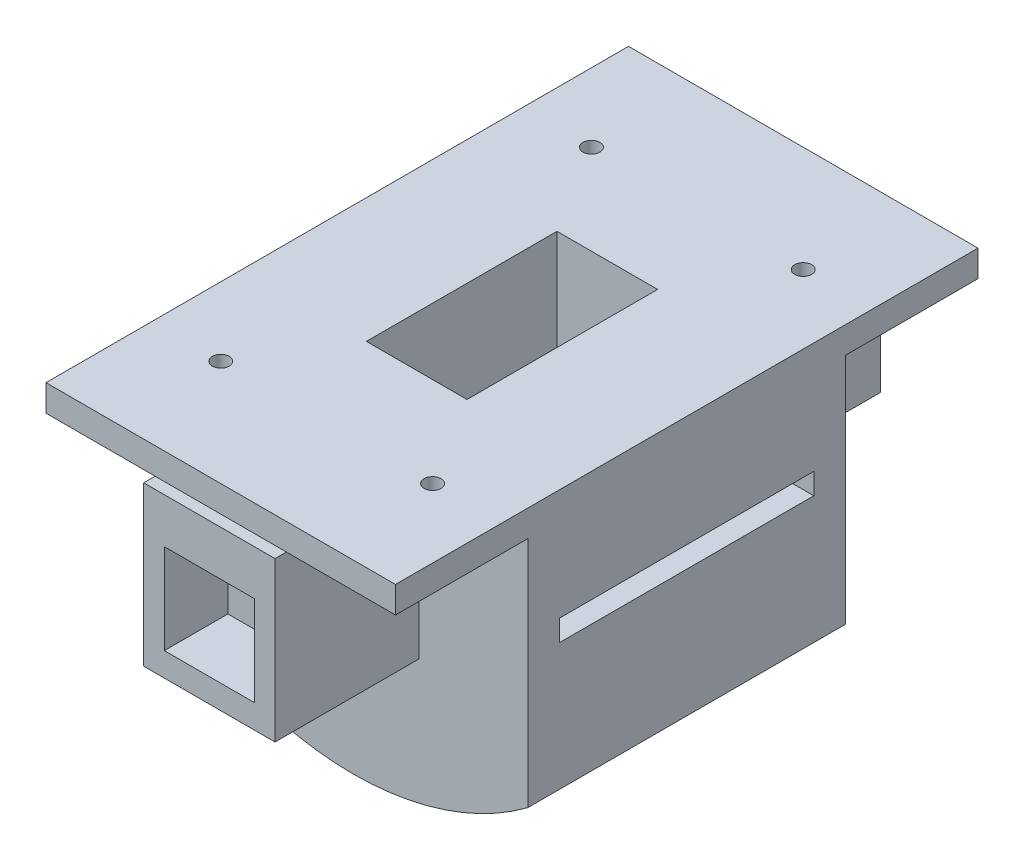
from build123d import *

# Parameters (mm, degrees)
BOSS_EXTRUDE1_DEPTH      = 30
BOSS_EXTRUDE1_DEPTH_BACK = 30
CUT_EXTRUDE1_DEPTH       = 18
CUT_EXTRUDE1_DEPTH_BACK  = 18
SKETCH2_W                = 19
SKETCH2_H                = 42
SKETCH3_W                = 21.854352608
SKETCH3_H                = 45
CUT_EXTRUDE2_DEPTH       = 99.234413522
SKETCH4_R                = 1.6
CUT_EXTRUDE3_DEPTH       = 84.366660003
SKETCH6_W                = 48
SKETCH6_H                = 4
CUT_EXTRUDE5_DEPTH       = 22
SKETCH9_W                = 22
SKETCH9_H                = 60
CUT_EXTRUDE7_DEPTH       = 84.366660003
SKETCH10_W               = 66
SKETCH10_H               = 110
SKETCH10_W_2             = 19
SKETCH10_H_2             = 36
BOSS_EXTRUDE2_DEPTH      = 5
SKETCH11_R               = 1.6
CUT_EXTRUDE8_DEPTH       = 88.82938005
SKETCH13_W               = 24.8
SKETCH13_H               = 30
BOSS_EXTRUDE3_DEPTH      = 27.15
SKETCH14_W               = 17
SKETCH14_H               = 17
CUT_EXTRUDE9_DEPTH       = 12


with BuildPart() as part:
    # Sketch1 → Boss-Extrude1 (new, two sides: drawn at the far end of the back side and taken through both)
    with BuildSketch(Plane.XY.offset(-BOSS_EXTRUDE1_DEPTH_BACK)):
        with BuildLine():
            Line((55, 0), (0, 0))
            Line((0, 0), (-55, 0))
            ThreePointArc((-55, 0), (0, -55), (55, 0))
        make_face()
    extrude(amount=BOSS_EXTRUDE1_DEPTH + BOSS_EXTRUDE1_DEPTH_BACK)

    # Sketch2 → Cut-Extrude1 (cut, two sides: drawn at the far end of the back side and taken through both)
    with BuildSketch(Plane.XY.offset(-CUT_EXTRUDE1_DEPTH_BACK)):
        with Locations((0, -21)):
            Rectangle(SKETCH2_W, SKETCH2_H)
    extrude(amount=CUT_EXTRUDE1_DEPTH + CUT_EXTRUDE1_DEPTH_BACK, mode=Mode.SUBTRACT)

    # Sketch3 → Cut-Extrude2 (cut, through all)
    with BuildSketch(Plane.XY.offset(30)):
        with Locations((-43.927176304, -26.5)):
            Rectangle(SKETCH3_W, SKETCH3_H)
        with Locations((43.927176304, -26.5)):
            Rectangle(SKETCH3_W, SKETCH3_H)
    extrude(amount=-CUT_EXTRUDE2_DEPTH, mode=Mode.SUBTRACT)

    # Sketch4 → Cut-Extrude3 (cut, through all)
    with BuildSketch(Plane(origin=(0, 0, 0), x_dir=(1, 0, 0), z_dir=(0, 1, 0))):
        with Locations((45, 20)):
            Circle(SKETCH4_R)
        with Locations((45, -20)):
            Circle(SKETCH4_R)
        with Locations((-45, -20)):
            Circle(SKETCH4_R)
        with Locations((-45, 20)):
            Circle(SKETCH4_R)
    extrude(amount=-CUT_EXTRUDE3_DEPTH, mode=Mode.SUBTRACT)

    # Sketch6 → Cut-Extrude5 (cut)
    with BuildSketch(Plane(origin=(33, 0, 0), x_dir=(0, 0, -1), z_dir=(1, 0, 0))):
        with Locations((0, -18)):
            Rectangle(SKETCH6_W, SKETCH6_H)
    extrude(amount=-CUT_EXTRUDE5_DEPTH, mode=Mode.SUBTRACT)

    # Sketch9 → Cut-Extrude7 (cut, through all)
    with BuildSketch(Plane(origin=(0, 0, 0), x_dir=(1, 0, 0), z_dir=(0, 1, 0))):
        with Locations((-44, 0)):
            Rectangle(SKETCH9_W, SKETCH9_H)
        with Locations((44, 0)):
            Rectangle(SKETCH9_W, SKETCH9_H)
    extrude(amount=-CUT_EXTRUDE7_DEPTH, mode=Mode.SUBTRACT)

    # Sketch10 → Boss-Extrude2 (add)
    with BuildSketch(Plane(origin=(0, 0, 0), x_dir=(1, 0, 0), z_dir=(0, 1, 0))):
        Rectangle(SKETCH10_W, SKETCH10_H)
        Rectangle(SKETCH10_W_2, SKETCH10_H_2, mode=Mode.SUBTRACT)
    extrude(amount=BOSS_EXTRUDE2_DEPTH)

    # Sketch11 → Cut-Extrude8 (cut, through all)
    with BuildSketch(Plane(origin=(0, 5, 0), x_dir=(1, 0, 0), z_dir=(0, 1, 0))):
        with Locations((-20, 35)):
            Circle(SKETCH11_R)
        with Locations((20, 35)):
            Circle(SKETCH11_R)
        with Locations((-20, -35)):
            Circle(SKETCH11_R)
        with Locations((20, -35)):
            Circle(SKETCH11_R)
    extrude(amount=-CUT_EXTRUDE8_DEPTH, mode=Mode.SUBTRACT)

    # Sketch13 → Boss-Extrude3 (add)
    with BuildSketch(Plane(origin=(0, 0, -30), x_dir=(-1, 0, 0), z_dir=(0, 0, -1))):
        with Locations((0, -15)):
            Rectangle(SKETCH13_W, SKETCH13_H)
    boss_extrude3 = extrude(amount=BOSS_EXTRUDE3_DEPTH)

    # Sketch14 → Cut-Extrude9 (cut)
    with BuildSketch(Plane(origin=(0, 0, -57.15), x_dir=(-1, 0, 0), z_dir=(0, 0, -1))):
        with Locations((0, -17)):
            Rectangle(SKETCH14_W, SKETCH14_H)
    cut_extrude9 = extrude(amount=-CUT_EXTRUDE9_DEPTH, mode=Mode.SUBTRACT)

    # Mirror2: Boss-Extrude3 across plane
    add(boss_extrude3.mirror(Plane(origin=(0, 0, 0), x_dir=(1, 0, 0), z_dir=(0, 0, -1))))

    # Mirror3: Cut-Extrude9 across plane
    add(cut_extrude9.mirror(Plane(origin=(0, 0, 0), x_dir=(1, 0, 0), z_dir=(0, 0, -1))), mode=Mode.SUBTRACT)


solid = part.part
